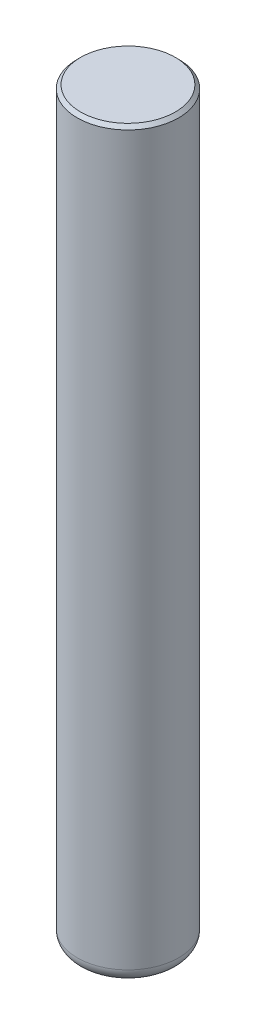
from build123d import *

# Parameters (mm, degrees)
SKETCH1_R           = 15
BOSS_EXTRUDE1_DEPTH = 220
FILLET1_R           = 4
CHAMFER1_SIZE       = 1


with BuildPart() as part:
    # Sketch1 → Boss-Extrude1 (new body)
    with BuildSketch(Plane(origin=(0, 0, 0), x_dir=(1, 0, 0), z_dir=(0, 1, 0))):
        Circle(SKETCH1_R)
    extrude(amount=BOSS_EXTRUDE1_DEPTH)

    # Fillet1
    fillet1_edges = [part.edges().sort_by_distance(p)[0] for p in [
        (-15, 0, 0),
    ]]
    fillet(fillet1_edges, radius=FILLET1_R)

    # Chamfer1
    chamfer1_edges = [part.edges().sort_by_distance(p)[0] for p in [
        (-15, 220, 0),
    ]]
    chamfer(chamfer1_edges, length=CHAMFER1_SIZE)


solid = part.part
